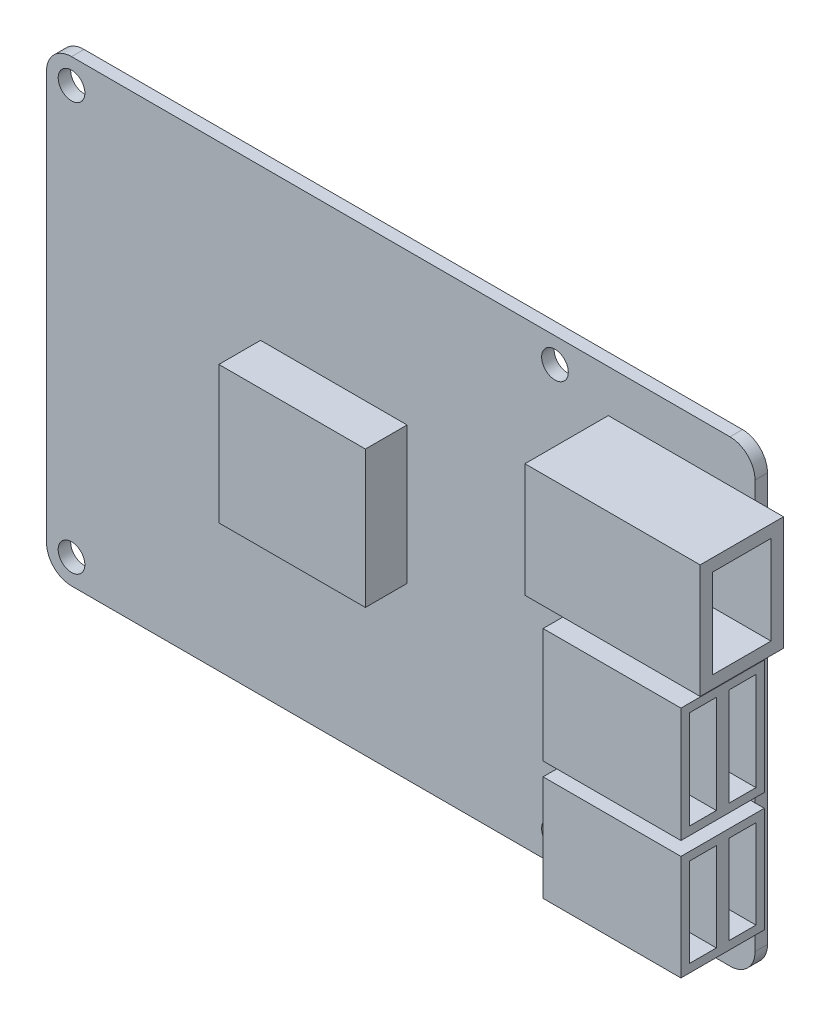
from build123d import *

# Parameters (mm, degrees)
SKETCH1_R           = 1.6
BOSS_EXTRUDE1_DEPTH = 1.5
SKETCH2_W           = 21.020817279
SKETCH2_H           = 13.668708773
SKETCH2_W_2         = 16.538575955
SKETCH2_H_2         = 13.76502595
SKETCH2_H_3         = 12.635061133
BOSS_EXTRUDE2_DEPTH = 10
SKETCH3_W           = 17.580136513
SKETCH3_H           = 16.463937369
BOSS_EXTRUDE3_DEPTH = 5
SKETCH4_W           = 7
SKETCH4_H           = 10.668708773
CUT_EXTRUDE1_DEPTH  = 15
SKETCH5_W           = 3.25
SKETCH5_H           = 10.635061133
SKETCH5_H_2         = 11.76502595
CUT_EXTRUDE2_DEPTH  = 15


with BuildPart() as part:
    # Sketch1 → Boss-Extrude1 (new body)
    with BuildSketch(Plane.XY):
        with BuildLine():
            Line((4.342063859, 22.576361327), (4.342063859, -26.423638673))
            ThreePointArc((4.342063859, -26.423638673), (5.220743515, -28.544959016), (7.342063859, -29.423638673))
            Line((7.342063859, -29.423638673), (86.342063859, -29.423638673))
            ThreePointArc((86.342063859, -29.423638673), (88.463384202, -28.544959016), (89.342063859, -26.423638673))
            Line((89.342063859, -26.423638673), (89.342063859, 22.576361327))
            ThreePointArc((89.342063859, 22.576361327), (88.463384202, 24.697681671), (86.342063859, 25.576361327))
            Line((86.342063859, 25.576361327), (7.342063859, 25.576361327))
            ThreePointArc((7.342063859, 25.576361327), (5.220743515, 24.697681671), (4.342063859, 22.576361327))
        make_face()
        with Locations((7.342063859, 22.576361327)):
            Circle(SKETCH1_R, mode=Mode.SUBTRACT)
        with Locations((65.342063859, 22.576361327)):
            Circle(SKETCH1_R, mode=Mode.SUBTRACT)
        with Locations((65.342063859, -26.423638673)):
            Circle(SKETCH1_R, mode=Mode.SUBTRACT)
        with Locations((7.342063859, -26.423638673)):
            Circle(SKETCH1_R, mode=Mode.SUBTRACT)
    extrude(amount=BOSS_EXTRUDE1_DEPTH)

    # Sketch2 → Boss-Extrude2 (add)
    with BuildSketch(Plane.XY.offset(1.5)):
        with Locations((82.249107191, 13.642831506)):
            Rectangle(SKETCH2_W, SKETCH2_H)
        with Locations((82.18632648, -2.437513953)):
            Rectangle(SKETCH2_W_2, SKETCH2_H_2)
        with Locations((82.18632648, -17.281142683)):
            Rectangle(SKETCH2_W_2, SKETCH2_H_3)
    extrude(amount=BOSS_EXTRUDE2_DEPTH)

    # Sketch3 → Boss-Extrude3 (add)
    with BuildSketch(Plane.XY.offset(1.5)):
        with Locations((38.810601532, -0.796926727)):
            Rectangle(SKETCH3_W, SKETCH3_H)
    extrude(amount=BOSS_EXTRUDE3_DEPTH)

    # Sketch4 → Cut-Extrude1 (cut)
    with BuildSketch(Plane(origin=(92.75951583, 0, 0), x_dir=(0, 0, -1), z_dir=(1, 0, 0))):
        with Locations((-6.5, 13.642831506)):
            Rectangle(SKETCH4_W, SKETCH4_H)
    extrude(amount=-CUT_EXTRUDE1_DEPTH, mode=Mode.SUBTRACT)

    # Sketch5 → Cut-Extrude2 (cut)
    with BuildSketch(Plane(origin=(90.455614457, 0, 0), x_dir=(0, 0, -1), z_dir=(1, 0, 0))):
        with Locations((-4.125, -17.281142683)):
            Rectangle(SKETCH5_W, SKETCH5_H)
        with Locations((-8.875, -17.281142683)):
            Rectangle(SKETCH5_W, SKETCH5_H)
        with Locations((-4.125, -2.437513953)):
            Rectangle(SKETCH5_W, SKETCH5_H_2)
        with Locations((-8.875, -2.437513953)):
            Rectangle(SKETCH5_W, SKETCH5_H_2)
    extrude(amount=-CUT_EXTRUDE2_DEPTH, mode=Mode.SUBTRACT)


solid = part.part
